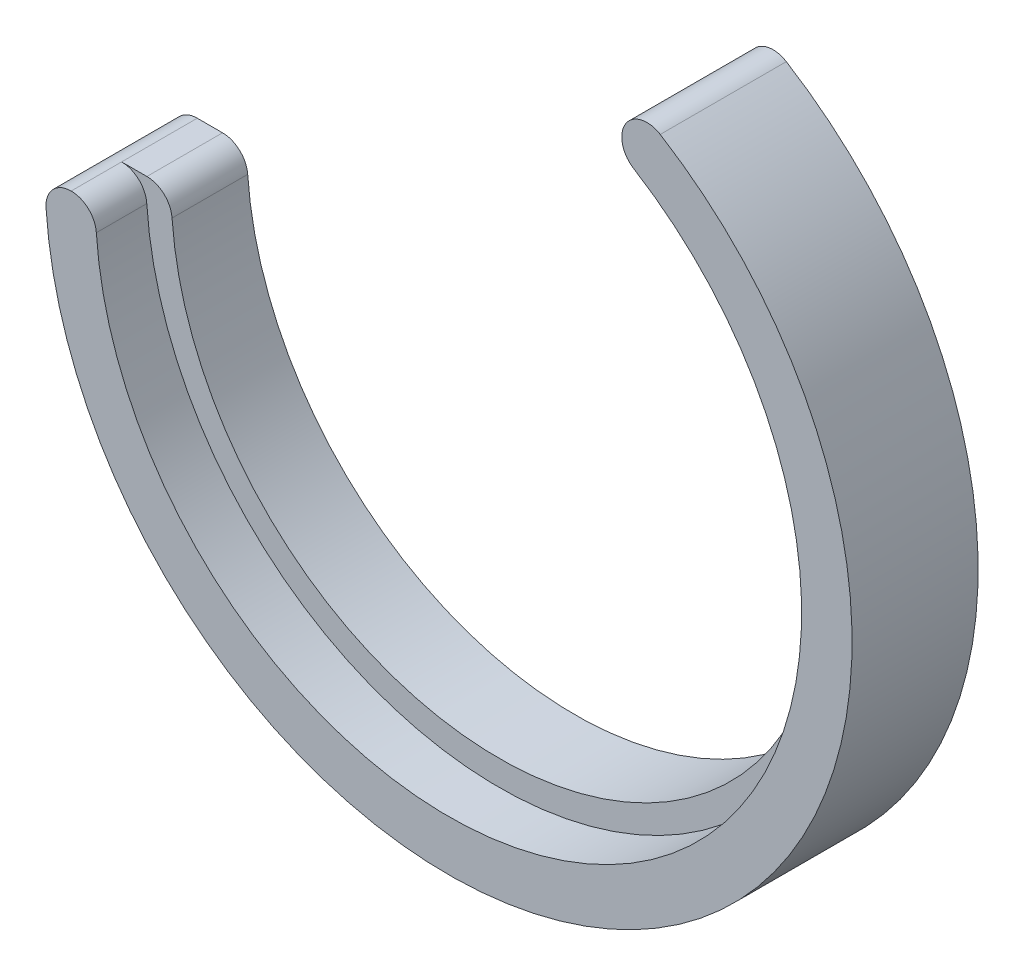
from build123d import *

# Parameters (mm, degrees)
BOSS_EXTRUDE1_DEPTH = 1.5
BOSS_EXTRUDE2_DEPTH = 1
FILLET1_R           = 0.5


with BuildPart() as part:
    # Sketch1 → Boss-Extrude1 (new body)
    with BuildSketch(Plane.XY):
        with BuildLine():
            Line((3.7329056464785526, 7.075691869668192), (3.032985837763823, 5.748999644105406))
            ThreePointArc((3.032985837763823, 5.748999644105406), (3.3567537930666855, -5.566166002980186), (-6.5, 0))
            Line((-6.5, 0), (-8, 9.8e-16))
            ThreePointArc((-8, 9.8e-16), (4.13138928377438, -6.850665849821768), (3.7329056464785526, 7.075691869668192))
        make_face()
    extrude(amount=BOSS_EXTRUDE1_DEPTH)

    # Sketch2 → Boss-Extrude2 (add)
    with BuildSketch(Plane.XY.offset(1.5)):
        with BuildLine():
            Line((3.7329056464785526, 7.075691869668192), (3.266292440668733, 6.191230385959669))
            ThreePointArc((3.266292440668733, 6.191230385959669), (3.6149656233025835, -5.994332618594048), (-7, 0))
            Line((-7, 0), (-8, 9.8e-16))
            ThreePointArc((-8, 9.8e-16), (4.13138928377438, -6.850665849821768), (3.7329056464785526, 7.075691869668192))
        make_face()
    extrude(amount=BOSS_EXTRUDE2_DEPTH)

    # Fillet1
    fillet1_edges = [part.edges().sort_by_distance(p)[0] for p in [
        (-6.5, -2.96e-15, 0.75),
        (-7, -3.17e-15, 2),
        (-8, 9.8e-16, 1.25),
        (3.2662924406687326, 6.191230385959669, 2),
        (3.032985837763823, 5.748999644105407, 0.75),
        (3.7329056464785557, 7.075691869668191, 1.25),
    ]]
    fillet(fillet1_edges, radius=FILLET1_R - 0.0001)  # a hair under: the kernel refuses the full size


solid = part.part
